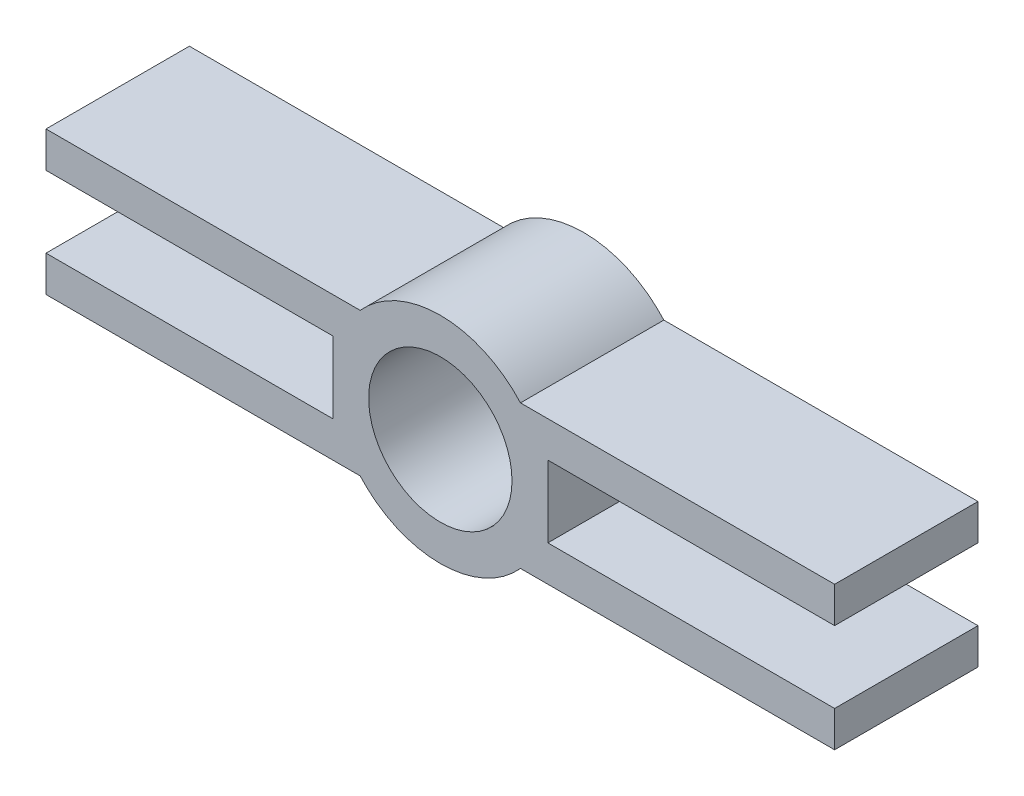
from build123d import *

# Parameters (mm, degrees)
SKETCH1_R           = 12.7
BOSS_EXTRUDE1_DEPTH = 25.4


with BuildPart() as part:
    # Sketch1 → Boss-Extrude1 (new body)
    with BuildSketch(Plane.XY):
        with BuildLine():
            Line((4.850968343, 0), (-50.8, 0))
            Line((-50.8, 0), (-50.8, 6.35))
            Line((-50.8, 6.35), (0, 6.35))
            Line((0, 6.35), (0, 19.05))
            Line((0, 19.05), (-50.8, 19.05))
            Line((-50.8, 19.05), (-50.8, 25.4))
            Line((-50.8, 25.4), (4.850968343, 25.4))
            ThreePointArc((4.850968343, 25.4), (19.05, 31.75), (33.249031657, 25.4))
            Line((33.249031657, 25.4), (88.9, 25.4))
            Line((88.9, 25.4), (88.9, 19.05))
            Line((88.9, 19.05), (38.1, 19.05))
            Line((38.1, 19.05), (38.1, 6.35))
            Line((38.1, 6.35), (88.9, 6.35))
            Line((88.9, 6.35), (88.9, 0))
            Line((88.9, 0), (33.249031657, 0))
            ThreePointArc((33.249031657, 0), (19.05, -6.35), (4.850968343, 0))
        make_face()
        with Locations((19.05, 12.7)):
            Circle(SKETCH1_R, mode=Mode.SUBTRACT)
    extrude(amount=BOSS_EXTRUDE1_DEPTH)


solid = part.part
